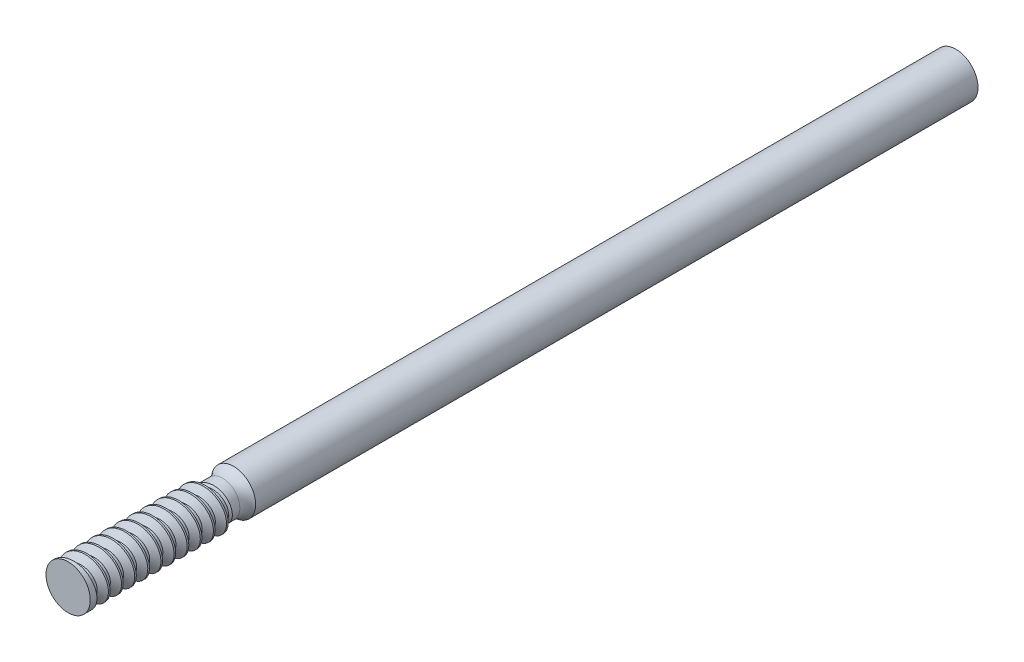
from build123d import *

# Parameters (mm, degrees)
SKETCH1_R           = 3.5687
BOSS_EXTRUDE1_DEPTH = 143.1544
THREAD1_PITCH       = 2.116666667
CUT_EXTRUDE1_START  = -26.67
SKETCH12_R          = 3.5687
SKETCH12_R_2        = 2.8194
CUT_EXTRUDE1_DEPTH  = 3.81
FILLET1_R           = 2.54


with BuildPart() as part:
    # Sketch1 → Boss-Extrude1 (new body)
    with BuildSketch(Plane.XY):
        Circle(SKETCH1_R)
    extrude(amount=BOSS_EXTRUDE1_DEPTH)

    # Thread1: the profile of Thread Profile1 profile screwed along a right-hand helix of 10.8 turns, 10 arcs to a turn; built about Z, then put on its axis
    thread1_z = Axis((0, 0, 0), (0, 0, 1))
    thread1_corners = [(3.569, 0, -0.000173205), (3.569, 0, 1.852256533), (2.423020565, 0, 1.190624997), (2.423020565, 0, 0.66145833)]
    with BuildLine(mode=Mode.PRIVATE) as thread1_profile:
        Line(thread1_corners[0], thread1_corners[1])
        Line(thread1_corners[1], thread1_corners[2])
        Line(thread1_corners[2], thread1_corners[3])
        Line(thread1_corners[3], thread1_corners[0])
    thread1_cap = Face(thread1_profile.wire())
    thread1_turn_angles = [0, 18, 36, 54, 72, 90, 108, 126, 144, 162, 180, 198, 216, 234, 252, 270, 288, 306, 324, 342, 360]
    thread1_turn_weights = [1, 0.9510565162951535, 1, 0.9510565162951535, 1, 0.9510565162951535, 1, 0.9510565162951535, 1, 0.9510565162951535, 1, 0.9510565162951535, 1, 0.9510565162951535, 1, 0.9510565162951535, 1, 0.9510565162951535, 1, 0.9510565162951535, 1]
    thread1_turn_rails = [Edge.make_bspline([Vector(p[0], p[1], 0).rotate(thread1_z, thread1_turn_angles[k]) / thread1_turn_weights[k] + Vector(0, 0, p[2] + THREAD1_PITCH * thread1_turn_angles[k] / 360) for k in range(21)], [0, 0, 0, 1, 1, 2, 2, 3, 3, 4, 4, 5, 5, 6, 6, 7, 7, 8, 8, 9, 9, 10, 10, 10], 2, thread1_turn_weights) for p in thread1_corners]
    thread1_turn_sides = [Face.make_surface_from_curves(thread1_turn_rails[p[0]], thread1_turn_rails[p[1]]) for p in [(0, 1), (1, 2), (2, 3), (3, 0)]]
    thread1_last_angles = [3600, 3618, 3636, 3654, 3672, 3690, 3708, 3726, 3744, 3762, 3780, 3798, 3816, 3834, 3852, 3870, 3888]
    thread1_last_weights = [1, 0.9510565162951535, 1, 0.9510565162951535, 1, 0.9510565162951535, 1, 0.9510565162951535, 1, 0.9510565162951535, 1, 0.9510565162951535, 1, 0.9510565162951535, 1, 0.9510565162951511, 1]
    thread1_last_rails = [Edge.make_bspline([Vector(p[0], p[1], 0).rotate(thread1_z, thread1_last_angles[k]) / thread1_last_weights[k] + Vector(0, 0, p[2] + THREAD1_PITCH * thread1_last_angles[k] / 360) for k in range(17)], [0, 0, 0, 1, 1, 2, 2, 3, 3, 4, 4, 5, 5, 6, 6, 7, 7, 8, 8, 8], 2, thread1_last_weights) for p in thread1_corners]
    thread1_last_sides = [Face.make_surface_from_curves(thread1_last_rails[p[0]], thread1_last_rails[p[1]]) for p in [(0, 1), (1, 2), (2, 3), (3, 0)]]
    thread1 = Plane(origin=(0, 0, 143.1544), x_dir=(-1, 0, 0), z_dir=(0, 0, -1)) * Solid(Shell([*[p.moved(Location((0, 0, THREAD1_PITCH * i))) for i in range(10) for p in thread1_turn_sides], *thread1_last_sides, thread1_cap, thread1_cap.rotate(thread1_z, 3888).moved(Location((0, 0, THREAD1_PITCH * 3888 / 360)))]))
    add(thread1, mode=Mode.SUBTRACT)

    # Sketch12 → Cut-Extrude1 (cut)
    with BuildSketch(Plane.XY.offset(143.1544).offset(CUT_EXTRUDE1_START)):
        Circle(SKETCH12_R)
        Circle(SKETCH12_R_2, mode=Mode.SUBTRACT)
    extrude(amount=CUT_EXTRUDE1_DEPTH, mode=Mode.SUBTRACT)

    # Fillet1
    # the kernel refuses this fillet: 2.54 mm, written as the material it adds along each edge
    with BuildSketch(Plane(origin=(0, 0, 116.4844), x_dir=(1, 0, 0), z_dir=(0, -1, 0))) as fillet1_piece_1:
        with BuildLine():
            CenterArc((5.3594, 1.801386552), FILLET1_R, 180, 45.17045595)
            Line((2.8194, 1.801386552), (2.7686, 1.801386552))
            Line((2.7686, 1.801386552), (2.7686, 0))
            Line((2.7686, 0), (2.8194, -0.0508))
            ThreePointArc((2.8194, -0.0508), (3.19405, -0.0508), (3.532886, -0.036027731))
            Line((3.532886, -0.036027731), (3.5687, 0))
        make_face()
    revolve(axis=Axis((0, 0, 116.4844), (0, 0, 1)))


solid = part.part
